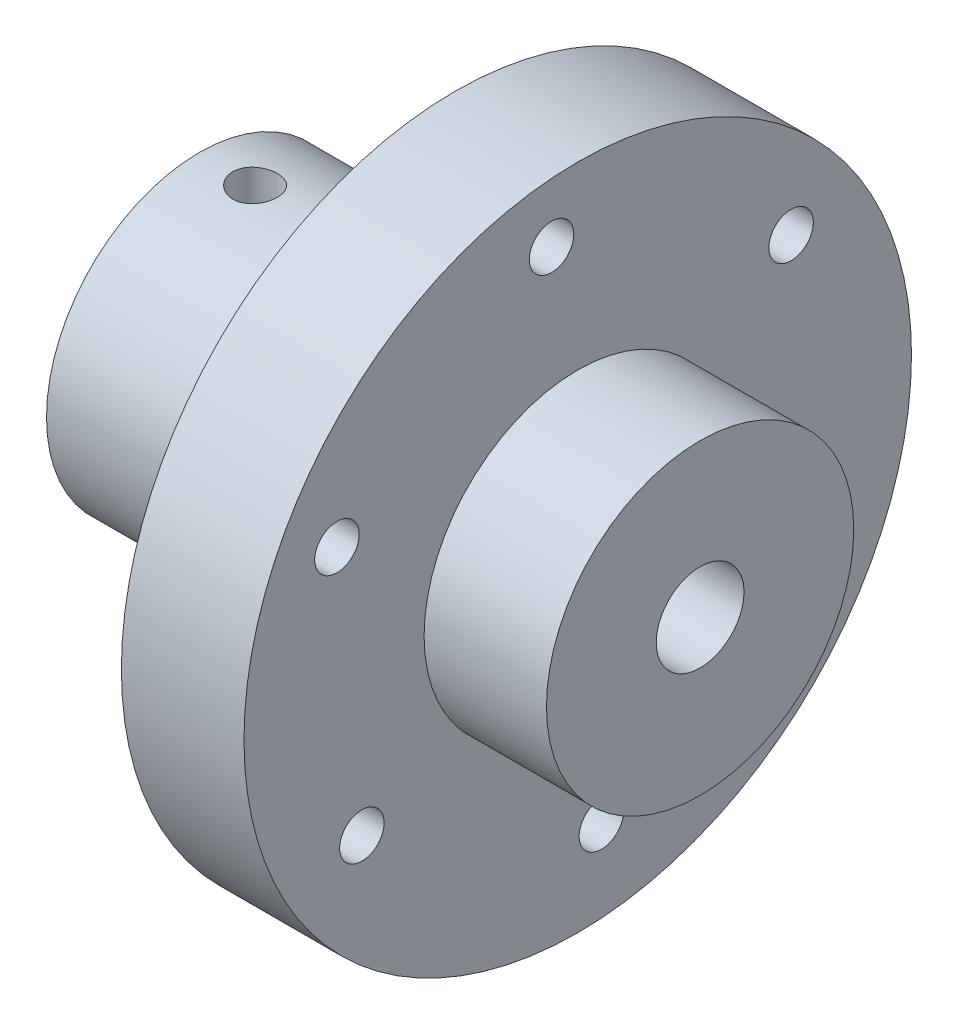
from build123d import *
from build123d.topology import SkipClean

# Parameters (mm, degrees)
SKETCH1_R                 = 13.75
SKETCH1_R_2               = 6
BOSS_EXTRUDE1_DEPTH       = 12
SKETCH2_R                 = 13.75
SKETCH2_R_2               = 4.01
BOSS_EXTRUDE3_DEPTH       = 10.98
SKETCH3_R                 = 30
BOSS_EXTRUDE4_DEPTH       = 11.02
F_4_0MM_DOWEL_HOLE1_D     = 4
F_4_0MM_DOWEL_HOLE1_DEPTH = 25.4
F_4_0MM_DOWEL_HOLE1_TIP   = 1.201721238
SKETCH11_W                = 4.05
SKETCH11_H                = 4.3
CUT_EXTRUDE1_DEPTH        = 10
CUT_EXTRUDE2_START        = -32
SKETCH15_R                = 4.01
CUT_EXTRUDE2_DEPTH        = 32
SKETCH16_R                = 13.810706785
SKETCH16_R_2              = 3.943549935
BOSS_EXTRUDE5_DEPTH       = 11


with BuildPart() as part:
    # Sketch1 → Boss-Extrude1 (new body)
    with BuildSketch(Plane(origin=(0, 0, 0), x_dir=(0, 0, -1), z_dir=(1, 0, 0))):
        Circle(SKETCH1_R)
        Circle(SKETCH1_R_2, mode=Mode.SUBTRACT)
    extrude(amount=BOSS_EXTRUDE1_DEPTH)

    # Sketch2 → Boss-Extrude3 (add)
    with BuildSketch(Plane(origin=(12, 0, 0), x_dir=(0, 0, -1), z_dir=(1, 0, 0))):
        with Locations(Location((0, 0, 0), (0, 0, 180))):
            Circle(SKETCH2_R)
        with Locations(Location((0, 0, 0), (0, 0, 180))):
            Circle(SKETCH2_R_2, mode=Mode.SUBTRACT)
    extrude(amount=BOSS_EXTRUDE3_DEPTH)

    # Sketch3 → Boss-Extrude4 (add)
    with BuildSketch(Plane(origin=(22.98, 0, 0), x_dir=(0, 0, -1), z_dir=(1, 0, 0))):
        with Locations(Location((0, 0, 0), (0, 0, 180))):
            Circle(SKETCH3_R)
    extrude(amount=BOSS_EXTRUDE4_DEPTH)

    # Ø4.0mm Dowel Hole1
    with Locations(Plane(origin=(34, 0, 0), x_dir=(0, 0, -1), z_dir=(1, 0, 0))):
        with Locations((-21.643670313, 10.843162234), (-2.353154811, 24.568381237), (19.178491269, 14.724914261), (21.419621846, -8.843771717), (-19.402539736, -12.725523744), (2.129106344, -22.56899072)):
            Hole(F_4_0MM_DOWEL_HOLE1_D / 2, depth=F_4_0MM_DOWEL_HOLE1_DEPTH)
            with Locations((0, 0, -(F_4_0MM_DOWEL_HOLE1_DEPTH + F_4_0MM_DOWEL_HOLE1_TIP / 2))):  # 118° drill point
                Cone(0, F_4_0MM_DOWEL_HOLE1_D / 2, F_4_0MM_DOWEL_HOLE1_TIP, mode=Mode.SUBTRACT)

    # Sketch11 → Cut-Extrude1 (cut)
    with BuildSketch(Plane.ZY):
        with Locations((0, 6)):
            Rectangle(SKETCH11_W, SKETCH11_H)
    extrude(amount=-CUT_EXTRUDE1_DEPTH, mode=Mode.SUBTRACT)

    # Sketch14 → Ø4.0mm Dowel Hole2 (revolve, cut)
    with BuildSketch(Plane(origin=(5, 8.15, 0), x_dir=(0, 0, -1), z_dir=(1, 0, 0))):
        Polygon((0, 0), (0, 26.601721238), (2, 25.4), (2, 0), align=None)
    revolve(axis=Axis((5, 1.8, 0), (0, 1, 0)), mode=Mode.SUBTRACT)

    # Sketch15 → Cut-Extrude2 (cut)
    with SkipClean():  # the faces are left unmerged after this step: merging them gives an invalid solid
        with BuildSketch(Plane(origin=(34, 0, 0), x_dir=(0, 0, -1), z_dir=(1, 0, 0)).offset(CUT_EXTRUDE2_START)):
            Circle(SKETCH15_R)
        extrude(amount=CUT_EXTRUDE2_DEPTH, mode=Mode.SUBTRACT)
    add(part.part.scale(1), mode=Mode.REPLACE)  # the faces are merged on a copy

    # Sketch16 → Boss-Extrude5 (add)
    with BuildSketch(Plane(origin=(34, 0, 0), x_dir=(0, 0, -1), z_dir=(1, 0, 0))):
        with Locations(Location((0, 0, 0), (0, 0, 180))):
            Circle(SKETCH16_R)
        with Locations(Location((0, 0.056450065, 0), (0, 0, 180))):
            Circle(SKETCH16_R_2, mode=Mode.SUBTRACT)
    extrude(amount=BOSS_EXTRUDE5_DEPTH)


solid = part.part
